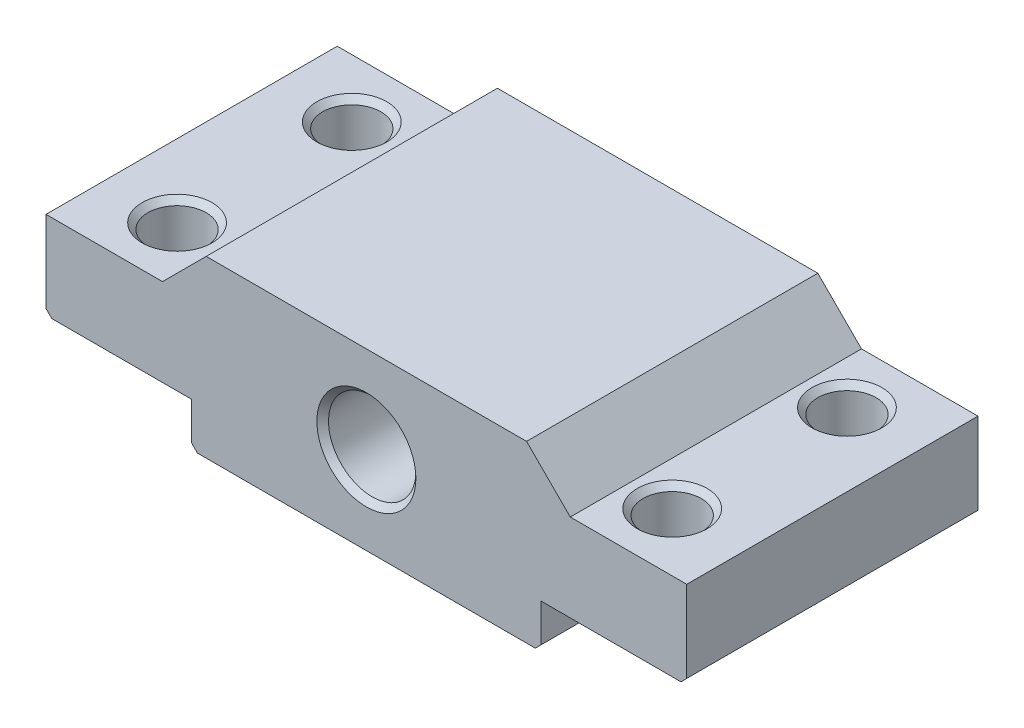
from build123d import *

# Parameters (mm, degrees)
BOSS_EXTRUDE1_DEPTH = 25
CHAMFER2_SIZE       = 10
HOLE1_D             = 15
CHAMFER3_SIZE       = 1
HOLE2_D             = 10
CHAMFER4_SIZE       = 1
CHAMFER5_SIZE       = 1


with BuildPart() as part:
    # Sketch1 → Boss-Extrude1 (new, symmetric)
    with BuildSketch(Plane.XY):
        Polygon((-55, -6.5), (-55, 7.5), (-25, 7.5), (-25, 15), (25, 15), (25, 7.5), (55, 7.5), (55, -6.5), (54, -7.5), (30, -7.5), (30, -14), (29, -15), (-29, -15), (-30, -14), (-30, -7.5), (-54, -7.5), align=None)
    extrude(amount=BOSS_EXTRUDE1_DEPTH, both=True)

    # Chamfer2
    # the kernel refuses this chamfer: 10 mm, written as the material it adds along each edge
    with BuildSketch(Plane(origin=(25, 7.5, 25), x_dir=(0.9996219169112968, -0.027495876610586403, 0), z_dir=(0, 0, -1))) as chamfer2_piece_1_section:
        Polygon((CHAMFER2_SIZE * 0.999621916911, -CHAMFER2_SIZE * 0.0274958766106), (-CHAMFER2_SIZE * 0.0274958766106, -CHAMFER2_SIZE * 0.999621916911), (0, 0), align=None)
    chamfer2_piece_1 = extrude(amount=50, mode=Mode.PRIVATE)
    chamfer2_piece_1 = split(chamfer2_piece_1, bisect_by=Plane(origin=(28.519591102, 15, 0), z_dir=(0, -1, 0)), keep=Keep.TOP, mode=Mode.PRIVATE)
    add(chamfer2_piece_1)
    with BuildSketch(Plane(origin=(-25, 7.5, 25), x_dir=(0.027495876610586317, 0.9996219169112968, 0), z_dir=(0, 0, -1))) as chamfer2_piece_2_section:
        Polygon((CHAMFER2_SIZE * 0.999621916911, -CHAMFER2_SIZE * 0.0274958766106), (-CHAMFER2_SIZE * 0.0274958766106, -CHAMFER2_SIZE * 0.999621916911), (0, 0), align=None)
    chamfer2_piece_2 = extrude(amount=50, mode=Mode.PRIVATE)
    chamfer2_piece_2 = split(chamfer2_piece_2, bisect_by=Plane(origin=(-28.519591102, 15, 0), z_dir=(0, -1, 0)), keep=Keep.TOP, mode=Mode.PRIVATE)
    add(chamfer2_piece_2)

    # Hole1 (through all)
    with Locations(Plane.XY.offset(25)):
        with Locations((0, 0)):
            Hole(HOLE1_D / 2)

    # Chamfer3
    chamfer3_edges = [part.edges().sort_by_distance(p)[0] for p in [
        (7.5, 0, 25),
        (7.5, 0, -25),
    ]]
    chamfer(chamfer3_edges, length=CHAMFER3_SIZE)

    # Hole2 (through all)
    with Locations(Plane(origin=(0, 7.5, 0), x_dir=(1, 0, 0), z_dir=(0, 1, 0))):
        with Locations((42.5, 15), (42.5, -15)):
            hole2 = Hole(HOLE2_D / 2)

    # Chamfer4
    chamfer4_edges = [part.edges().sort_by_distance(p)[0] for p in [
        (47.5, 7.5, 15),
        (47.5, -7.5, 15),
        (47.5, 7.5, -15),
        (47.5, -7.5, -15),
    ]]
    chamfer(chamfer4_edges, length=CHAMFER4_SIZE)

    # Mirror5: Hole2 across plane
    add(hole2.mirror(Plane(origin=(0, 0, 0), x_dir=(0, 0, 1), z_dir=(1, 0, 0))), mode=Mode.SUBTRACT)

    # Chamfer5
    chamfer5_edges = [part.edges().sort_by_distance(p)[0] for p in [
        (-47.5, 7.5, 15),
        (-47.5, -7.5, 15),
        (-47.5, 7.5, -15),
        (-47.5, -7.5, -15),
    ]]
    chamfer(chamfer5_edges, length=CHAMFER5_SIZE)


solid = part.part
